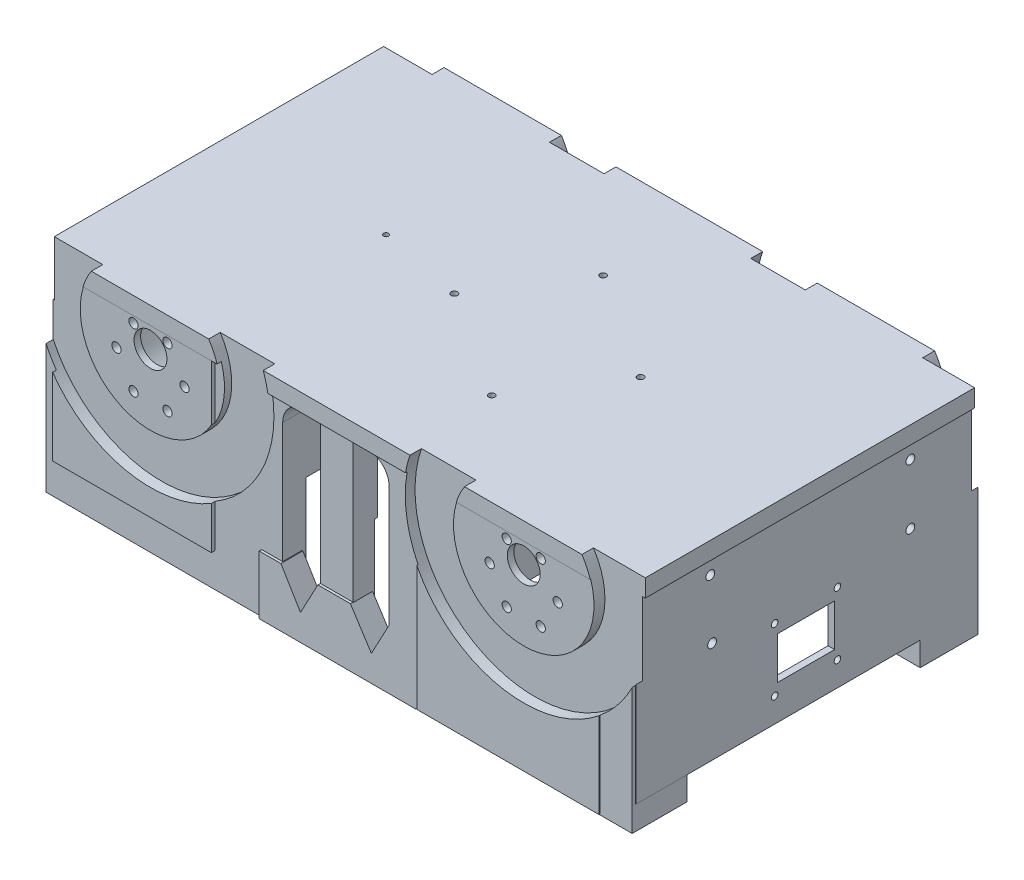
from build123d import *
from OCP.BRepAlgoAPI import BRepAlgoAPI_Cut
from OCP.TopTools import TopTools_ListOfShape

# Parameters (mm, degrees)
MOTORHOLDERS_DEPTH             = 80
MOTORHOLDERS_DEPTH_BACK        = 80
MOTORHOLDERSSKETCH_R           = 23.41
MOTORHOLDERS_2_DEPTH           = 80
MOTORHOLDERS_2_DEPTH_BACK      = 80
SKETCH4_W                      = 262.774983374
SKETCH4_H                      = 153.112553215
CUT_EXTRUDE1_DEPTH             = 26
POWERBANKHOLDERS_DEPTH         = 40
POWERBANKHOLDERS_DEPTH_BACK    = 59
SKETCH6_W                      = 107.485666349
SKETCH6_H                      = 13.420779118
SKETCH6_W_2                    = 20.810206851
SKETCH6_H_2                    = 2.021058642
POWERBANKHOLDERS_2_DEPTH       = 40
POWERBANKHOLDERS_2_DEPTH_BACK  = 59
SKETCH6_W_3                    = 107.81575089
SKETCH6_H_3                    = 38.261259506
SKETCH6_W_4                    = 10.842850571
SKETCH6_H_4                    = 10.347679347
POWERBANKHOLDERS_3_DEPTH       = 40
POWERBANKHOLDERS_3_DEPTH_BACK  = 59
SKETCH6_W_5                    = 41.498763714
SKETCH6_H_5                    = 37.111507406
SKETCH6_W_6                    = 12.844328805
SKETCH6_H_6                    = 18.336479725
SKETCH6_W_7                    = 4.801433035
SKETCH6_H_7                    = 16.443461188
POWERBANKHOLDERS_4_DEPTH       = 40
POWERBANKHOLDERS_4_DEPTH_BACK  = 59
SKETCH6_W_8                    = 41.763104176
SKETCH6_H_8                    = 35.272094794
SKETCH6_W_9                    = 11.134493861
SKETCH6_H_9                    = 18.035399163
SKETCH6_W_10                   = 4.654088682
SKETCH6_H_10                   = 14.436538778
POWERBANKHOLDERS_5_DEPTH       = 40
POWERBANKHOLDERS_5_DEPTH_BACK  = 59
SKETCH6_W_11                   = 17.763333386
SKETCH6_H_11                   = 11.185766025
POWERBANKHOLDERS_6_DEPTH       = 40
POWERBANKHOLDERS_6_DEPTH_BACK  = 59
SKETCH6_W_12                   = 14.811929009
SKETCH6_H_12                   = 11.030658464
POWERBANKHOLDERS_7_DEPTH       = 40
POWERBANKHOLDERS_7_DEPTH_BACK  = 59
SKETCH6_W_13                   = 28.150495439
SKETCH6_H_13                   = 24.933985152
SKETCH6_W_14                   = 10.177859407
SKETCH6_H_14                   = 9.83070569
POWERBANKHOLDERS_8_DEPTH       = 40
POWERBANKHOLDERS_8_DEPTH_BACK  = 59
SKETCH6_W_15                   = 30.670744753
SKETCH6_H_15                   = 26.330219561
SKETCH6_W_16                   = 9.898416255
SKETCH6_H_16                   = 10.635603546
BOTTOMPLATE_DEPTH              = 5
BOTTOMPLATE_DEPTH_BACK         = 3
SKETCH21_R                     = 156.395305675
SKETCH23_W                     = 72.331231332
SKETCH23_H                     = 81.163054316
SKETCH23_W_2                   = 82.936115801
SKETCH23_H_2                   = 96.211163908
MOTORMOUNTINGSUPPORT1_DEPTH    = 6
SKETCH24_W                     = 78.341994801
SKETCH24_H                     = 94.439711356
SKETCH24_W_2                   = 53.914675369
SKETCH24_H_2                   = 86.674739968
MOTORMOUNTINGSUPPOR2_DEPTH     = 6
SKETCH17_R                     = 2.1
SKETCH17_R_2                   = 7.5
MOTORHOLES1_DEPTH              = 31.5
SKETCH19_R                     = 2.1
SKETCH19_R_2                   = 7.5
CUT_EXTRUDE4_DEPTH             = 30
BOLTHOLESSKETCH3_R             = 2.1
BOLTHOLESSKETCH3_R_2           = 7.5
MOTORHOLES3_DEPTH              = 31.5
BOLTHOLESSKETCH4_R             = 2.1
BOLTHOLESSKETCH4_R_2           = 7.5
MOTORHOLES4_DEPTH              = 15
SKETCH29_W                     = 154.635205036
SKETCH29_H                     = 84.131588093
SKETCH29_W_2                   = 26
SKETCH29_H_2                   = 19.212652328
BOSS_EXTRUDE8_DEPTH            = 3
SKETCH27_W                     = 226.46009322
SKETCH27_H                     = 129.985211715
BOSS_EXTRUDE6_DEPTH            = 3
SKETCH40_W                     = 33.841577611
SKETCH40_H                     = 31.531825246
BOSS_EXTRUDE11_DEPTH           = 40
FILLET2_R                      = 15
FILLET3_R                      = 15
POWERBANKCUT_START             = -54.404272
POWERBANKCUT_DEPTH             = 54.404272
MOTORHOLDERCUT_DEPTH           = 77
MOTORHOLDERCUT_DEPTH_BACK      = 77
MOTORHOLDEREXTRUDESKETCH_R     = 20.415
BASEDEFININGCUT_DEPTH          = 20
BASEDEFININGCUT_DEPTH_BACK     = 20
SKETCH32_W                     = 420.045569038
SKETCH32_H                     = 425.046527557
SKETCH32_W_2                   = 269.205670794
SKETCH32_H_2                   = 160.645125556
SKETCH36_R                     = 14
HOLEFORPOWERCONNECTOR_DEPTH    = 17
SKETCH37_W                     = 55.340133611
SKETCH37_H                     = 29.7708905
CUT_EXTRUDE7_DEPTH             = 36
SKETCH38_R                     = 1.145182774
CUT_EXTRUDE8_DEPTH             = 10
SPACEFORWHEEL1_DEPTH           = 10
SPACEFORWHEEL1_DEPTH_BACK      = 5
SKETCH41_R                     = 54.5
SKETCH41_R_2                   = 32
CUT_EXTRUDE10_DEPTH            = 10
CUT_EXTRUDE10_DEPTH_BACK       = 5
SKETCH42_R                     = 54.5
SKETCH42_R_2                   = 32
CUT_EXTRUDE11_DEPTH            = 10
CUT_EXTRUDE11_DEPTH_BACK       = 5
SKETCH43_R                     = 54.5
SKETCH43_R_2                   = 32
CUT_EXTRUDE12_DEPTH            = 10
CUT_EXTRUDE12_DEPTH_BACK       = 5
SKETCH44_R                     = 54.5
SKETCH44_R_2                   = 32
SKETCH45_W                     = 114.137539603
SKETCH45_H                     = 98.697181704
BACKPLATE_DEPTH                = 2
FILLET8_R                      = 10
FILLET9_R                      = 10
FILLET10_R                     = 10
FILLET11_R                     = 10
BOSS_EXTRUDE12_DEPTH           = 10
BOSS_EXTRUDE13_DEPTH           = 9
HOLESFORRASPIMOUNTING_R        = 1.414568566
HOLESFORRASPIMOUNTING_R_2      = 1.453568018
HOLESFORRASPIMOUNTING_R_3      = 1.430265165
HOLESFORRASPIMOUNTING_R_4      = 1.406429506
CUT_EXTRUDE13_DEPTH            = 252.922030729
HOLESFORCHARGINGPLATESSKETCH_R = 2
HOLESFORCHARGINGPLATES_DEPTH   = 3
SKETCH56_R                     = 1.5
CAMERASCREWHOLES_DEPTH         = 3
CUT_EXTRUDE14_START            = -15.098537
SKETCH57_R                     = 14
CUT_EXTRUDE14_DEPTH            = 15.098537


with BuildPart() as part:
    # MotorHoldersSketch → MotorHolders (new, two sides: drawn at the far end of the back side and taken through both)
    with BuildSketch(Plane.XY.offset(-MOTORHOLDERS_DEPTH_BACK)):
        Circle(MOTORHOLDERSSKETCH_R)
    extrude(amount=MOTORHOLDERS_DEPTH + MOTORHOLDERS_DEPTH_BACK)


with BuildPart() as body_2:
    # MotorHoldersSketch → MotorHolders 2 (new, two sides: drawn at the far end of the back side and taken through both)
    with BuildSketch(Plane.XY.offset(-MOTORHOLDERS_2_DEPTH_BACK)):
        with Locations((170, 0)):
            Circle(MOTORHOLDERSSKETCH_R)
    extrude(amount=MOTORHOLDERS_2_DEPTH + MOTORHOLDERS_2_DEPTH_BACK)


with BuildPart() as cut_extrude1_tool:
    # Sketch4 → Cut-Extrude1 (new body)
    with BuildSketch(Plane(origin=(0, 0, 0), x_dir=(1, 0, 0), z_dir=(0, 1, 0))):
        with Locations((89.893628689, 0.176832173)):
            Rectangle(SKETCH4_W, SKETCH4_H)
    extrude(amount=-CUT_EXTRUDE1_DEPTH)


with BuildPart() as part_1:
    add(part.part)

    # Cut-Extrude1: cut by cut_extrude1_tool
    add(cut_extrude1_tool.part, mode=Mode.SUBTRACT)


with BuildPart() as body_2_1:
    add(body_2.part)

    # Cut-Extrude1: cut by cut_extrude1_tool
    add(cut_extrude1_tool.part, mode=Mode.SUBTRACT)


with BuildPart() as body_3:
    # Sketch6 → PowerBankHolders (new, two sides: drawn at the far end of the back side and taken through both)
    with BuildSketch(Plane(origin=(170, -34.829272125, 0), x_dir=(-1, 0, 0), z_dir=(0, -1, 0)).offset(-POWERBANKHOLDERS_DEPTH_BACK)):
        with Locations((165.843013364, 72.238602394)):
            Rectangle(SKETCH6_W, SKETCH6_H)
        with Locations((203.359863582, 72.025840015)):
            Rectangle(SKETCH6_W_2, SKETCH6_H_2, mode=Mode.SUBTRACT)
    extrude(amount=POWERBANKHOLDERS_DEPTH + POWERBANKHOLDERS_DEPTH_BACK)



with BuildPart() as body_4:
    # Sketch6 → PowerBankHolders 2 (new, two sides: drawn at the far end of the back side and taken through both)
    with BuildSketch(Plane(origin=(170, -34.829272125, 0), x_dir=(-1, 0, 0), z_dir=(0, -1, 0)).offset(-POWERBANKHOLDERS_2_DEPTH_BACK)):
        with Locations((165.406852056, -59.151522269)):
            Rectangle(SKETCH6_W_3, SKETCH6_H_3)
        with Locations((206.519672379, -65.314281269)):
            Rectangle(SKETCH6_W_4, SKETCH6_H_4, mode=Mode.SUBTRACT)
    extrude(amount=POWERBANKHOLDERS_2_DEPTH + POWERBANKHOLDERS_2_DEPTH_BACK)


with BuildPart() as body_5:
    # Sketch6 → PowerBankHolders 3 (new, two sides: drawn at the far end of the back side and taken through both)
    with BuildSketch(Plane(origin=(170, -34.829272125, 0), x_dir=(-1, 0, 0), z_dir=(0, -1, 0)).offset(-POWERBANKHOLDERS_3_DEPTH_BACK)):
        with Locations((40.739743063, 59.306920349)):
            Rectangle(SKETCH6_W_5, SKETCH6_H_5)
        with Locations((34.93306737, 60.00949088)):
            Rectangle(SKETCH6_W_6, SKETCH6_H_6, mode=Mode.SUBTRACT)
        with Locations((56.270377412, 59.541495334)):
            Rectangle(SKETCH6_W_7, SKETCH6_H_7, mode=Mode.SUBTRACT)
    extrude(amount=POWERBANKHOLDERS_3_DEPTH + POWERBANKHOLDERS_3_DEPTH_BACK)


with BuildPart() as body_6:
    # Sketch6 → PowerBankHolders 4 (new, two sides: drawn at the far end of the back side and taken through both)
    with BuildSketch(Plane(origin=(170, -34.829272125, 0), x_dir=(-1, 0, 0), z_dir=(0, -1, 0)).offset(-POWERBANKHOLDERS_4_DEPTH_BACK)):
        with Locations((40.966801585, -61.807610384)):
            Rectangle(SKETCH6_W_8, SKETCH6_H_8)
        with Locations((37.73953158, -63.792391966)):
            Rectangle(SKETCH6_W_9, SKETCH6_H_9, mode=Mode.SUBTRACT)
        with Locations((54.037759341, -62.645522509)):
            Rectangle(SKETCH6_W_10, SKETCH6_H_10, mode=Mode.SUBTRACT)
    extrude(amount=POWERBANKHOLDERS_4_DEPTH + POWERBANKHOLDERS_4_DEPTH_BACK)


with BuildPart() as body_7:
    # Sketch6 → PowerBankHolders 5 (new, two sides: drawn at the far end of the back side and taken through both)
    with BuildSketch(Plane(origin=(170, -34.829272125, 0), x_dir=(-1, 0, 0), z_dir=(0, -1, 0)).offset(-POWERBANKHOLDERS_5_DEPTH_BACK)):
        with Locations((88.297855443, 73.356108941)):
            Rectangle(SKETCH6_W_11, SKETCH6_H_11)
    extrude(amount=POWERBANKHOLDERS_5_DEPTH + POWERBANKHOLDERS_5_DEPTH_BACK)


with BuildPart() as body_8:
    # Sketch6 → PowerBankHolders 6 (new, two sides: drawn at the far end of the back side and taken through both)
    with BuildSketch(Plane(origin=(170, -34.829272125, 0), x_dir=(-1, 0, 0), z_dir=(0, -1, 0)).offset(-POWERBANKHOLDERS_6_DEPTH_BACK)):
        with Locations((86.822153254, -72.76682279)):
            Rectangle(SKETCH6_W_12, SKETCH6_H_12)
    extrude(amount=POWERBANKHOLDERS_6_DEPTH + POWERBANKHOLDERS_6_DEPTH_BACK)


with BuildPart() as body_9:
    # Sketch6 → PowerBankHolders 7 (new, two sides: drawn at the far end of the back side and taken through both)
    with BuildSketch(Plane(origin=(170, -34.829272125, 0), x_dir=(-1, 0, 0), z_dir=(0, -1, 0)).offset(-POWERBANKHOLDERS_7_DEPTH_BACK)):
        with Locations((-34.775388772, -66.976665205)):
            Rectangle(SKETCH6_W_13, SKETCH6_H_13)
        with Locations((-36.725173705, -67.894738702)):
            Rectangle(SKETCH6_W_14, SKETCH6_H_14, mode=Mode.SUBTRACT)
    extrude(amount=POWERBANKHOLDERS_7_DEPTH + POWERBANKHOLDERS_7_DEPTH_BACK)


with BuildPart() as body_10:
    # Sketch6 → PowerBankHolders 8 (new, two sides: drawn at the far end of the back side and taken through both)
    with BuildSketch(Plane(origin=(170, -34.829272125, 0), x_dir=(-1, 0, 0), z_dir=(0, -1, 0)).offset(-POWERBANKHOLDERS_8_DEPTH_BACK)):
        with Locations((-33.722690809, 64.697564271)):
            Rectangle(SKETCH6_W_15, SKETCH6_H_15)
        with Locations((-36.585452129, 63.859928969)):
            Rectangle(SKETCH6_W_16, SKETCH6_H_16, mode=Mode.SUBTRACT)
    extrude(amount=POWERBANKHOLDERS_8_DEPTH + POWERBANKHOLDERS_8_DEPTH_BACK)


with BuildPart() as body_3_1:
    add(body_3.part)

    add(body_4.part)  # BottomPlate merges body 4

    add(body_2_1.part)  # BottomPlate merges body 2

    add(part_1.part)  # BottomPlate merges part

    add(body_5.part)  # BottomPlate merges body 5

    add(body_6.part)  # BottomPlate merges body 6
    # Sketch21 → BottomPlate (add, two sides: drawn at the far end of the back side and taken through both)
    with BuildSketch(Plane(origin=(0, 19.575, 0), x_dir=(1, 0, 0), z_dir=(0, 1, 0)).offset(-BOTTOMPLATE_DEPTH_BACK)):
        with Locations(Location((85, 0, 0), (0, 0, 270))):
            Circle(SKETCH21_R)
    extrude(amount=BOTTOMPLATE_DEPTH + BOTTOMPLATE_DEPTH_BACK)


    add(body_9.part)  # MotorMountingSupport1 merges body 9
    # Sketch23 → MotorMountingSupport1 (add)
    with BuildSketch(Plane.XY.offset(80)):
        with Locations((-8.424510745, -18.741332274)):
            Rectangle(SKETCH23_W, SKETCH23_H)
        with Locations((162.789906406, -26.26538707)):
            Rectangle(SKETCH23_W_2, SKETCH23_H_2)
    extrude(amount=-MOTORMOUNTINGSUPPORT1_DEPTH)


    add(body_10.part)  # MotorMountingSuppor2 merges body 10
    # Sketch24 → MotorMountingSuppor2 (add)
    with BuildSketch(Plane(origin=(0, 0, -80), x_dir=(-1, 0, 0), z_dir=(0, 0, -1))):
        with Locations((-163.019522912, -27.982448794)):
            Rectangle(SKETCH24_W, SKETCH24_H)
        with Locations((2.593149567, -20.814772641)):
            Rectangle(SKETCH24_W_2, SKETCH24_H_2)
    extrude(amount=-MOTORMOUNTINGSUPPOR2_DEPTH)

    # Sketch17 → MotorHoles1 (cut)
    with BuildSketch(Plane.XY.offset(80)):
        with Locations((185.5, 0)):
            Circle(SKETCH17_R)
        with Locations((177.75, -13.42)):
            Circle(SKETCH17_R)
        with Locations((162.25, -13.42)):
            Circle(SKETCH17_R)
        with Locations((154.5, 0)):
            Circle(SKETCH17_R)
        with Locations((162.25, 13.42)):
            Circle(SKETCH17_R)
        with Locations((177.75, 13.42)):
            Circle(SKETCH17_R)
        with Locations((170, 7)):
            Circle(SKETCH17_R_2)
    extrude(amount=-MOTORHOLES1_DEPTH, mode=Mode.SUBTRACT)

    # Sketch19 → Cut-Extrude4 (cut)
    with BuildSketch(Plane(origin=(0, 0, -80), x_dir=(-1, 0, 0), z_dir=(0, 0, -1))):
        with Locations(Location((-185.5, 0, 0), (0, 0, 180))):
            Circle(SKETCH19_R)
        with Locations(Location((-177.75, -13.42, 0), (0, 0, 180))):
            Circle(SKETCH19_R)
        with Locations(Location((-162.25, -13.42, 0), (0, 0, 180))):
            Circle(SKETCH19_R)
        with Locations(Location((-154.5, 0, 0), (0, 0, 180))):
            Circle(SKETCH19_R)
        with Locations(Location((-162.25, 13.42, 0), (0, 0, 180))):
            Circle(SKETCH19_R)
        with Locations(Location((-177.75, 13.42, 0), (0, 0, 180))):
            Circle(SKETCH19_R)
        with Locations(Location((-170, 7, 0), (0, 0, 180))):
            Circle(SKETCH19_R_2)
    extrude(amount=-CUT_EXTRUDE4_DEPTH, mode=Mode.SUBTRACT)

    # BoltHolesSketch3 → MotorHoles3 (cut)
    with BuildSketch(Plane.XY.offset(80)):
        with Locations((7.75, -13.42)):
            Circle(BOLTHOLESSKETCH3_R)
        with Locations((15.5, 0)):
            Circle(BOLTHOLESSKETCH3_R)
        with Locations((7.75, 13.42)):
            Circle(BOLTHOLESSKETCH3_R)
        with Locations((-7.75, 13.42)):
            Circle(BOLTHOLESSKETCH3_R)
        with Locations((-15.5, 0)):
            Circle(BOLTHOLESSKETCH3_R)
        with Locations((-7.75, -13.42)):
            Circle(BOLTHOLESSKETCH3_R)
        with Locations((0, 7)):
            Circle(BOLTHOLESSKETCH3_R_2)
    extrude(amount=-MOTORHOLES3_DEPTH, mode=Mode.SUBTRACT)

    # BoltHolesSketch4 → MotorHoles4 (cut)
    with BuildSketch(Plane(origin=(0, 0, -80), x_dir=(-1, 0, 0), z_dir=(0, 0, -1))):
        with Locations(Location((-15.5, 0, 0), (0, 0, 180))):
            Circle(BOLTHOLESSKETCH4_R)
        with Locations(Location((-7.75, 13.42, 0), (0, 0, 180))):
            Circle(BOLTHOLESSKETCH4_R)
        with Locations(Location((7.75, 13.42, 0), (0, 0, 180))):
            Circle(BOLTHOLESSKETCH4_R)
        with Locations(Location((15.5, 0, 0), (0, 0, 180))):
            Circle(BOLTHOLESSKETCH4_R)
        with Locations(Location((7.75, -13.42, 0), (0, 0, 180))):
            Circle(BOLTHOLESSKETCH4_R)
        with Locations(Location((-7.75, -13.42, 0), (0, 0, 180))):
            Circle(BOLTHOLESSKETCH4_R)
        with Locations(Location((0, 7, 0), (0, 0, 180))):
            Circle(BOLTHOLESSKETCH4_R_2)
    extrude(amount=-MOTORHOLES4_DEPTH, mode=Mode.SUBTRACT)

    # Sketch29 → Boss-Extrude8 (add)
    with BuildSketch(Plane(origin=(219.058063185, 0, 0), x_dir=(0, 0, -1), z_dir=(1, 0, 0))):
        with Locations((-0.622085312, -21.859578752)):
            Rectangle(SKETCH29_W, SKETCH29_H)
        with Locations((-0.45071267, -38.546737855)):
            Rectangle(SKETCH29_W_2, SKETCH29_H_2, mode=Mode.SUBTRACT)
    extrude(amount=-BOSS_EXTRUDE8_DEPTH)

    # Sketch27 → Boss-Extrude6 (add)
    with BuildSketch(Plane(origin=(0, 16.575, 0), x_dir=(-1, 0, 0), z_dir=(0, -1, 0))):
        with Locations((-81.596376522, -0.440920076)):
            Rectangle(SKETCH27_W, SKETCH27_H)
    extrude(amount=-BOSS_EXTRUDE6_DEPTH)

    # Sketch40 → Boss-Extrude11 (add)
    with BuildSketch(Plane.XZ.offset(-16.575)):
        with Locations((-32.665057733, -49.762300212)):
            Rectangle(SKETCH40_W, SKETCH40_H)
    extrude(amount=BOSS_EXTRUDE11_DEPTH)

    # Fillet2
    fillet2_edges = [body_3_1.edges().sort_by_distance(p)[0] for p in [
        (-33.058778866, 16.575, -33.996387589),
    ]]
    fillet(fillet2_edges, radius=FILLET2_R)

    # Fillet3
    fillet3_edges = [body_3_1.edges().sort_by_distance(p)[0] for p in [
        (-32.665057733, -23.425, -65.528212835),
    ]]
    fillet(fillet3_edges, radius=FILLET3_R)


with BuildPart() as powerbankcut_tool:
    # Sketch11 → PowerBankCut (new body)
    with BuildSketch(Plane(origin=(0, -20.425, 0), x_dir=(1, 0, 0), z_dir=(0, 1, 0)).offset(POWERBANKCUT_START)):
        Polygon((-34.216190018, -64.758061011), (-34.216190018, 73.342459946), (204.216190018, 63.61100878), (204.216190018, -72.195407715), align=None)
    extrude(amount=POWERBANKCUT_DEPTH)


with BuildPart() as body_3_2:
    add(body_3_1.part)

    # PowerBankCut: cut by powerbankcut_tool
    add(powerbankcut_tool.part, mode=Mode.SUBTRACT)

    # MotorHolderExtrudeSketch → MotorHolderCut (cut, two sides: drawn at the far end of the back side and taken through both)
    with BuildSketch(Plane.XY.offset(-MOTORHOLDERCUT_DEPTH_BACK)):
        with Locations((170, 0)):
            Circle(MOTORHOLDEREXTRUDESKETCH_R)
        Circle(MOTORHOLDEREXTRUDESKETCH_R)
    extrude(amount=MOTORHOLDERCUT_DEPTH + MOTORHOLDERCUT_DEPTH_BACK, mode=Mode.SUBTRACT)

    # Sketch32 → BaseDefiningCut (cut, two sides: drawn at the far end of the back side and taken through both)
    with BuildSketch(Plane(origin=(0, 19.575, 0), x_dir=(1, 0, 0), z_dir=(0, 1, 0)).offset(-BASEDEFININGCUT_DEPTH_BACK)):
        with Locations((73.53385004, -6.203492346)):
            Rectangle(SKETCH32_W, SKETCH32_H)
        with Locations((85.789158114, 0.107563087)):
            Rectangle(SKETCH32_W_2, SKETCH32_H_2, mode=Mode.SUBTRACT)
    extrude(amount=BASEDEFININGCUT_DEPTH + BASEDEFININGCUT_DEPTH_BACK, mode=Mode.SUBTRACT)

    # Sketch36 → HoleForPowerConnector (cut)
    with BuildSketch(Plane.ZY.offset(49.314727501)):
        with Locations((55.06657986, -55.074157533)):
            Circle(SKETCH36_R)
    extrude(amount=-HOLEFORPOWERCONNECTOR_DEPTH, mode=Mode.SUBTRACT)

    # Sketch37 → Cut-Extrude7 (cut)
    with BuildSketch(Plane.XZ.offset(20.425)):
        with Locations((116.745978541, -50.558354808)):
            Rectangle(SKETCH37_W, SKETCH37_H)
    extrude(amount=-CUT_EXTRUDE7_DEPTH, mode=Mode.SUBTRACT)

    # Sketch38 → Cut-Extrude8 (cut)
    with BuildSketch(Plane.XZ.offset(-16.575)):
        with Locations(Location((25.99644574, -1.316498015, 0), (0, 0, 270))):
            Circle(SKETCH38_R)
    extrude(amount=-CUT_EXTRUDE8_DEPTH, mode=Mode.SUBTRACT)

    # Sketch41 → SpaceForWheel1 (cut, two sides: drawn at the far end of the back side and taken through both)
    with BuildSketch(Plane.XY.offset(80).offset(-SPACEFORWHEEL1_DEPTH_BACK)):
        with Locations((0, 7)):
            Circle(SKETCH41_R)
        with Locations((0, 7)):
            Circle(SKETCH41_R_2, mode=Mode.SUBTRACT)
    extrude(amount=SPACEFORWHEEL1_DEPTH + SPACEFORWHEEL1_DEPTH_BACK, mode=Mode.SUBTRACT)

    # Sketch42 → Cut-Extrude10 (cut, two sides: drawn at the far end of the back side and taken through both)
    with BuildSketch(Plane.XY.offset(80).offset(-CUT_EXTRUDE10_DEPTH_BACK)):
        with Locations((170, 7)):
            Circle(SKETCH42_R)
        with Locations((170, 7)):
            Circle(SKETCH42_R_2, mode=Mode.SUBTRACT)
    extrude(amount=CUT_EXTRUDE10_DEPTH + CUT_EXTRUDE10_DEPTH_BACK, mode=Mode.SUBTRACT)

    # Sketch43 → Cut-Extrude11 (cut, two sides: drawn at the far end of the back side and taken through both)
    with BuildSketch(Plane(origin=(0, 0, -80), x_dir=(-1, 0, 0), z_dir=(0, 0, -1)).offset(-CUT_EXTRUDE11_DEPTH_BACK)):
        with Locations((-170, 7)):
            Circle(SKETCH43_R)
        with Locations((-170, 7)):
            Circle(SKETCH43_R_2, mode=Mode.SUBTRACT)
    extrude(amount=CUT_EXTRUDE11_DEPTH + CUT_EXTRUDE11_DEPTH_BACK, mode=Mode.SUBTRACT)

    # Sketch44 → Cut-Extrude12 (cut, two sides: drawn at the far end of the back side and taken through both)
    with BuildSketch(Plane(origin=(0, 0, -80), x_dir=(-1, 0, 0), z_dir=(0, 0, -1)).offset(-CUT_EXTRUDE12_DEPTH_BACK)):
        with Locations((0, 7)):
            Circle(SKETCH44_R)
        with Locations((0, 7)):
            Circle(SKETCH44_R_2, mode=Mode.SUBTRACT)
    extrude(amount=CUT_EXTRUDE12_DEPTH + CUT_EXTRUDE12_DEPTH_BACK, mode=Mode.SUBTRACT)

    # Sketch45 → BackPlate (add)
    with BuildSketch(Plane.ZY.offset(48.813677283)):
        with Locations((-15.037538426, -24.773590852)):
            Rectangle(SKETCH45_W, SKETCH45_H)
    extrude(amount=-BACKPLATE_DEPTH)

    # Fillet8
    fillet8_edges = [body_3_2.edges().sort_by_distance(p)[0] for p in [
        (57.89981981, 16.575, -72.238602394),
    ]]
    fillet(fillet8_edges, radius=FILLET8_R)

    # Fillet9
    # the kernel refuses this fillet: 10 mm, written as the material it adds along each edge
    with BuildSketch(Plane(origin=(108.51087508, 16.575, -77.862674052), x_dir=(0, -1, 0), z_dir=(0, 0, 1))) as fillet9_piece_1_section:
        with BuildLine():
            CenterArc((FILLET9_R, -FILLET9_R), FILLET9_R, 90, 90)
            Line((0, -FILLET9_R), (0, 0))
            Line((0, 0), (FILLET9_R, 0))
        make_face()
    fillet9_piece_1 = extrude(amount=37.111507406, mode=Mode.PRIVATE)
    fillet9_piece_1 = split(fillet9_piece_1, bisect_by=Plane(origin=(108.51087508, 15.575, -77.862674052), z_dir=(0, -1, 0)), keep=Keep.TOP, mode=Mode.PRIVATE)
    fillet9_piece_1 = split(fillet9_piece_1, bisect_by=Plane(origin=(108.51087508, 16.575, -65.443800058), z_dir=(0, 0, -1)), keep=Keep.TOP, mode=Mode.PRIVATE)
    add(fillet9_piece_1)
    with BuildSketch(Plane(origin=(108.51087508, 16.575, -77.862674052), x_dir=(0, -1, 0), z_dir=(0, 0, 1))) as fillet9_piece_2_section:
        with BuildLine():
            CenterArc((FILLET9_R, -FILLET9_R), FILLET9_R, 90, 90)
            Line((0, -FILLET9_R), (0, 0))
            Line((0, 0), (FILLET9_R, 0))
        make_face()
    fillet9_piece_2 = extrude(amount=37.111507406, mode=Mode.PRIVATE)
    fillet9_piece_2 = split(fillet9_piece_2, bisect_by=Plane(origin=(108.51087508, 15.575, -77.862674052), z_dir=(0, 1, 0)), keep=Keep.TOP, mode=Mode.PRIVATE)
    fillet9_piece_2 = split(fillet9_piece_2, bisect_by=Plane(origin=(108.51087508, 16.575, -65.443800058), z_dir=(0, 0, -1)), keep=Keep.TOP, mode=Mode.PRIVATE)
    add(fillet9_piece_2)
    with BuildSketch(Plane(origin=(108.51087508, 16.575, -77.862674052), x_dir=(0, -1, 0), z_dir=(0, 0, 1))) as fillet9_piece_3_section:
        with BuildLine():
            CenterArc((FILLET9_R, -FILLET9_R), FILLET9_R, 90, 90)
            Line((0, -FILLET9_R), (0, 0))
            Line((0, 0), (FILLET9_R, 0))
        make_face()
    fillet9_piece_3 = extrude(amount=37.111507406, mode=Mode.PRIVATE)
    fillet9_piece_3 = split(fillet9_piece_3, bisect_by=Plane(origin=(108.51087508, 15.575, -77.862674052), z_dir=(0, 1, 0)), keep=Keep.TOP, mode=Mode.PRIVATE)
    fillet9_piece_3 = split(fillet9_piece_3, bisect_by=Plane(origin=(108.51087508, 16.575, -65.443800058), z_dir=(0, 0, 1)), keep=Keep.TOP, mode=Mode.PRIVATE)
    add(fillet9_piece_3)

    # Fillet10
    fillet10_edges = [body_3_2.edges().sort_by_distance(p)[0] for p in [
        (108.151646327, 16.575, 61.807610384),
    ]]
    fillet(fillet10_edges, radius=FILLET10_R)

    # Fillet11
    fillet11_edges = [body_3_2.edges().sort_by_distance(p)[0] for p in [
        (58.501023389, 16.575, 59.151522269),
    ]]
    fillet(fillet11_edges, radius=FILLET11_R)



with BuildPart() as body_7_1:
    add(body_7.part)

    # PowerBankCut: cut by powerbankcut_tool
    add(powerbankcut_tool.part, mode=Mode.SUBTRACT)


with BuildPart() as body_8_1:
    add(body_8.part)

    # PowerBankCut: cut by powerbankcut_tool
    add(powerbankcut_tool.part, mode=Mode.SUBTRACT)


with BuildPart() as body_3_3:
    add(body_3_2.part)

    add(body_8_1.part)  # Boss-Extrude12 merges body 8
    # Sketch51 → Boss-Extrude12 (add)
    with BuildSketch(Plane.XY.offset(79.443657781)):
        Polygon((108.151646327, -47.98038528), (100.046955512, -63.179220835), (90.516348019, -48.336772286), (75.676177949, -48.336772286), (67.761528435, -63.179220835), (58.839832918, -48.336772286), (48.929052362, -48.336772286), (48.929052362, -75.040734929), (120.251371925, -75.040734929), (120.251371925, -47.98038528), align=None)
    extrude(amount=-BOSS_EXTRUDE12_DEPTH)


    add(body_7_1.part)  # Boss-Extrude13 merges body 7
    # Sketch53 → Boss-Extrude13 (add)
    with BuildSketch(Plane(origin=(0, 0, -77.862674052), x_dir=(-1, 0, 0), z_dir=(0, 0, -1))):
        Polygon((-57.799247354, -55.761623835), (-64.666800666, -65.107182533), (-72.754062458, -55.761623835), (-90.655375706, -55.761623835), (-98.668066194, -65.107182533), (-108.51087508, -55.761623835), (-123.848525511, -55.761623835), (-123.848525511, -74.829272125), (-52.438264255, -74.829272125), (-52.438264255, -55.761623835), align=None)
    extrude(amount=-BOSS_EXTRUDE13_DEPTH)

    # HolesForRasPiMounting → Cut-Extrude13 (cut, through all)
    with BuildSketch(Plane.XZ.offset(-16.575)):
        with Locations(Location((91.467826322, -34.695989326, 0), (0, 0, 270))):
            Circle(HOLESFORRASPIMOUNTING_R)
        with Locations(Location((64.780513606, 6.398868504, 0), (0, 0, 270))):
            Circle(HOLESFORRASPIMOUNTING_R_2)
        with Locations(Location((140.110719263, -3.106925295, 0), (0, 0, 270))):
            Circle(HOLESFORRASPIMOUNTING_R_3)
        with Locations(Location((113.423406547, 37.987932534, 0), (0, 0, 270))):
            Circle(HOLESFORRASPIMOUNTING_R_4)
    extrude(amount=-CUT_EXTRUDE13_DEPTH, mode=Mode.SUBTRACT)

    # HolesForChargingPlatesSketch → HolesForChargingPlates (cut)
    with BuildSketch(Plane(origin=(219.058063185, 0, 0), x_dir=(0, 0, -1), z_dir=(1, 0, 0))):
        with Locations((47.060045129, -17.739047969)):
            Circle(HOLESFORCHARGINGPLATESSKETCH_R)
        with Locations((-43.254232653, -17.739047969)):
            Circle(HOLESFORCHARGINGPLATESSKETCH_R)
        with Locations((-44.046532468, 9.537592727)):
            Circle(HOLESFORCHARGINGPLATESSKETCH_R)
        with Locations((47.060045129, 9.537592727)):
            Circle(HOLESFORCHARGINGPLATESSKETCH_R)
    extrude(amount=-HOLESFORCHARGINGPLATES_DEPTH, mode=Mode.SUBTRACT)

    # Sketch56 → CameraScrewHoles (cut)
    with BuildSketch(Plane(origin=(219.058063185, 0, 0), x_dir=(0, 0, -1), z_dir=(1, 0, 0))):
        with Locations((13.842180549, -52.839631074)):
            Circle(SKETCH56_R)
        with Locations((-14.743605889, -52.839631074)):
            Circle(SKETCH56_R)
        with Locations((-14.743605889, -24.253844636)):
            Circle(SKETCH56_R)
        with Locations((13.842180549, -24.253844636)):
            Circle(SKETCH56_R)
    extrude(amount=-CAMERASCREWHOLES_DEPTH, mode=Mode.SUBTRACT)


with BuildPart() as cut_extrude14_tool:
    # Sketch57 → Cut-Extrude14 (new body)
    with BuildSketch(Plane.ZY.offset(49.314727501).offset(CUT_EXTRUDE14_START)):
        with Locations((55.06657986, -37.552205603)):
            Circle(SKETCH57_R)
    extrude(amount=CUT_EXTRUDE14_DEPTH)


with BuildPart() as body_3_4:
    add(body_3_3.part)

    # Cut-Extrude14: cut by cut_extrude14_tool, with a tolerance
    cut_extrude14_stock = TopTools_ListOfShape()
    cut_extrude14_stock.Append(body_3_4.part.wrapped)
    cut_extrude14_tools = TopTools_ListOfShape()
    cut_extrude14_tools.Append(cut_extrude14_tool.part.wrapped)
    cut_extrude14_cut = BRepAlgoAPI_Cut()
    cut_extrude14_cut.SetArguments(cut_extrude14_stock)
    cut_extrude14_cut.SetTools(cut_extrude14_tools)
    cut_extrude14_cut.SetFuzzyValue(0.00001)
    cut_extrude14_cut.Build()
    add(Compound.cast(cut_extrude14_cut.Shape()).solids(), mode=Mode.REPLACE)


solid = body_3_4.part
